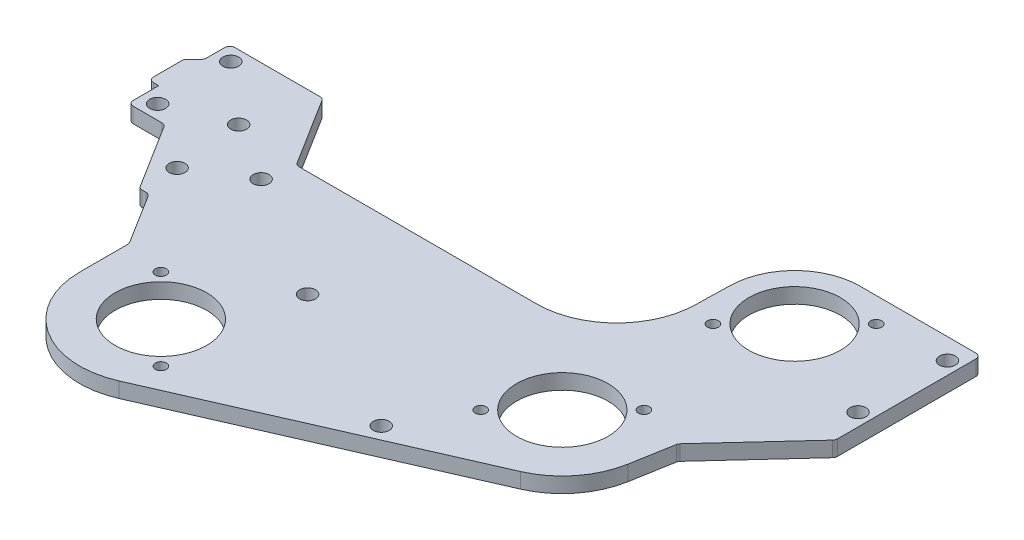
from build123d import *

# Parameters (mm, degrees)
SKETCH1_R                 = 14.29004
BOSS_EXTRUDE1_DEPTH       = 4.7625
F_10_CLEARANCE_HOLE1_D    = 4.9784
F_10_CLEARANCE_HOLE2_D    = 4.9784
TAP_DRILL_FOR_8_32_TAP1_D = 3.4544
F_10_CLEARANCE_HOLE3_D    = 4.9784
FILLET1_R                 = 1.5875


with BuildPart() as part:
    # Sketch1 → Boss-Extrude1 (new body)
    with BuildSketch(Plane(origin=(0, 0, 0), x_dir=(1, 0, 0), z_dir=(0, 1, 0))):
        with BuildLine():
            Line((-62.038222018, -79.883349745), (25.167081601, -41.695780276))
            ThreePointArc((25.167081601, -41.695780276), (34.91524479, -34.148496119), (39.940188099, -22.890693115))
            Line((39.940188099, -22.890693115), (42.275148896, -9.586739751))
            Line((42.275148896, -9.586739751), (65.831008632, 16.012754812))
            Line((65.831008632, 16.012754812), (65.831008632, 61.493591694))
            Line((65.831008632, 61.493591694), (28.046575186, 61.493591694))
            ThreePointArc((28.046575186, 61.493591694), (13.665119108, 55.581463016), (7.599980341, 41.263864189))
            Line((7.599980341, 41.263864189), (7.377499016, 31.276274442))
            ThreePointArc((7.377499016, 31.276274442), (0.022382465, 13.519452313), (-17.734439664, 6.164335762))
            Line((-17.734439664, 6.164335762), (-92.776174625, 6.164335762))
            Line((-92.776174625, 6.164335762), (-106.671272051, 28.401139958))
            Line((-106.671272051, 28.401139958), (-135.754553791, 28.401139958))
            Line((-135.754553791, 28.401139958), (-135.754553791, 20.45773786))
            Line((-135.754553791, 20.45773786), (-138.929553791, 17.28273786))
            Line((-138.929553791, 17.28273786), (-138.929553791, 6.164335762))
            Line((-138.929553791, 6.164335762), (-135.754553791, 6.164335762))
            Line((-135.754553791, 6.164335762), (-135.754553791, -3.360664238))
            Line((-135.754553791, -3.360664238), (-124.263208355, -3.360664238))
            Line((-124.263208355, -3.360664238), (-110.958501432, -24.652646126))
            Line((-110.958501432, -24.652646126), (-107.963388287, -24.652646126))
            Line((-107.963388287, -24.652646126), (-97.659911134, -41.141656383))
            Line((-97.659911134, -41.141656383), (-97.659911134, -56.628468385))
            ThreePointArc((-97.659911134, -56.628468385), (-86.144175153, -77.898718987), (-62.038222018, -79.883349745))
        make_face()
        with Locations((28.046575186, 41.045834415)):
            Circle(SKETCH1_R, mode=Mode.SUBTRACT)
        with Locations((15.031008632, -18.508482198)):
            Circle(SKETCH1_R, mode=Mode.SUBTRACT)
        with Locations((-72.258332946, -56.628468385)):
            Circle(SKETCH1_R, mode=Mode.SUBTRACT)
    extrude(amount=BOSS_EXTRUDE1_DEPTH)

    # #10 Clearance Hole1 (through all)
    with Locations(Plane(origin=(0, 4.7625, 0), x_dir=(1, 0, 0), z_dir=(0, 1, 0))):
        with Locations((61.830508632, 55.015834415), (61.830508632, 27.075834415), (-130.992053791, 23.944335762), (-130.992053791, 1.084335762)):
            Hole(F_10_CLEARANCE_HOLE1_D / 2)

    # #10 Clearance Hole2 (through all)
    with Locations(Plane(origin=(0, 4.7625, 0), x_dir=(1, 0, 0), z_dir=(0, 1, 0))):
        with Locations((-110.620877013, -13.210000682), (-94.465560781, -3.115038698), (-112.732400526, 8.143579493)):
            Hole(F_10_CLEARANCE_HOLE2_D / 2)

    # Tap Drill for #8-32 Tap1 (through all)
    with Locations(Plane(origin=(0, 4.7625, 0), x_dir=(1, 0, 0), z_dir=(0, 1, 0))):
        with Locations((-85.010296638, -43.876504694), (-59.506369254, -69.380432077), (2.27904494, -31.26044589), (27.782972324, -5.756518506), (15.294611495, 28.293870723), (40.798538878, 53.797798107)):
            Hole(TAP_DRILL_FOR_8_32_TAP1_D / 2)

    # #10 Clearance Hole3 (through all)
    with Locations(Plane(origin=(0, 4.7625, 0), x_dir=(1, 0, 0), z_dir=(0, 1, 0))):
        with Locations((-56.041369259, -27.019222928), (-8.951277081, -51.090630662)):
            Hole(F_10_CLEARANCE_HOLE3_D / 2)

    # Fillet1
    fillet1_edges = [part.edges().sort_by_distance(p)[0] for p in [
        (-135.754553791, 2.38125, 3.360664238),
        (-124.263208355, 2.38125, 3.360664238),
        (65.831008632, 2.38125, -61.493591694),
        (65.831008632, 2.38125, -16.012754812),
        (42.275148896, 2.38125, 9.586739751),
        (-97.659911134, 2.38125, 41.141656383),
        (-92.776174625, 2.38125, -6.164335762),
        (-106.671272051, 2.38125, -28.401139958),
        (-138.929553791, 2.38125, -17.28273786),
        (-107.963388287, 2.38125, 24.652646126),
        (-110.958501432, 2.38125, 24.652646126),
        (-135.754553791, 2.38125, -28.401139958),
        (-135.754553791, 2.38125, -20.45773786),
        (-138.929553791, 2.38125, -6.164335762),
    ]]
    fillet(fillet1_edges, radius=FILLET1_R)


solid = part.part
